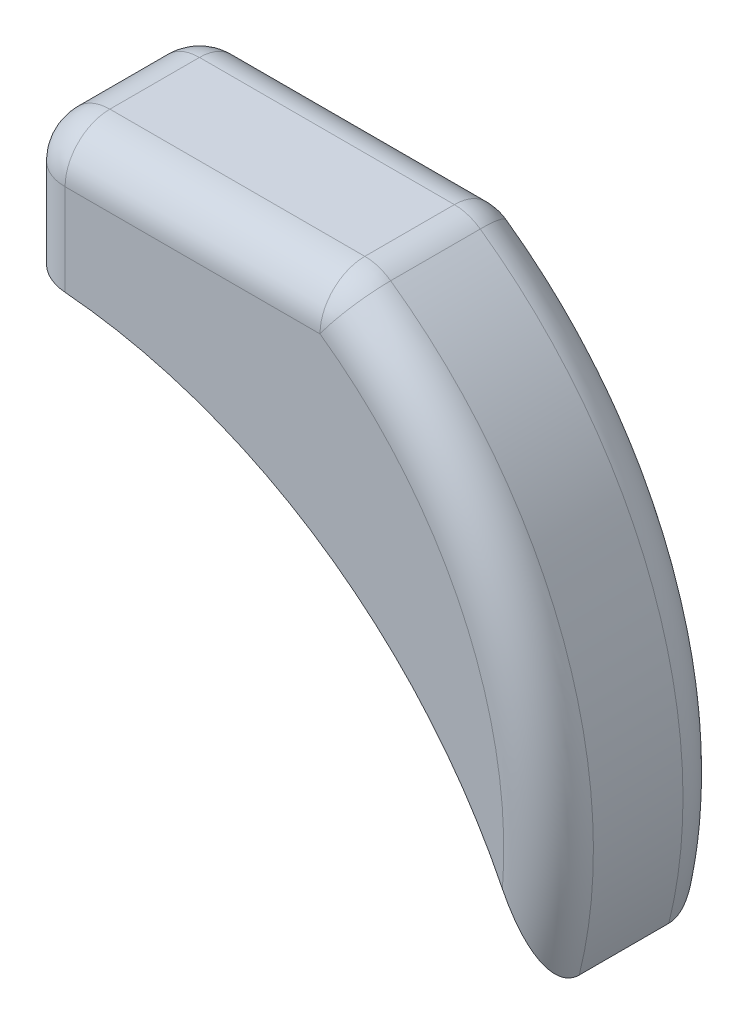
from build123d import *

# Parameters (mm, degrees)
BOSS_EXTRU_1_DEPTH = 20
CONG_2_R           = 10


with BuildPart() as part:
    # Esquisse1 → Boss.-Extru.1 (new, symmetric)
    with BuildSketch(Plane.XY):
        with BuildLine():
            Line((35, 15), (-35, 15))
            Line((-35, 15), (-35, -15))
            ThreePointArc((-35, -15), (36.414284285, -38.56349239), (79.782402832, -100))
            ThreePointArc((79.782402832, -100), (75.641274878, -35.393198769), (35, 15))
        make_face()
    extrude(amount=BOSS_EXTRU_1_DEPTH, both=True)

    # Congé2
    cong_2_edges = [part.edges().sort_by_distance(p)[0] for p in [
        (35, 15, 0),
        (75.641274878, -35.393198769, -20),
        (75.641274878, -35.393198769, 20),
        (0, 15, 20),
        (0, 15, -20),
        (-35, 0, 20),
        (-35, 0, -20),
        (-35, 15, 0),
    ]]
    fillet(cong_2_edges, radius=CONG_2_R)


solid = part.part
